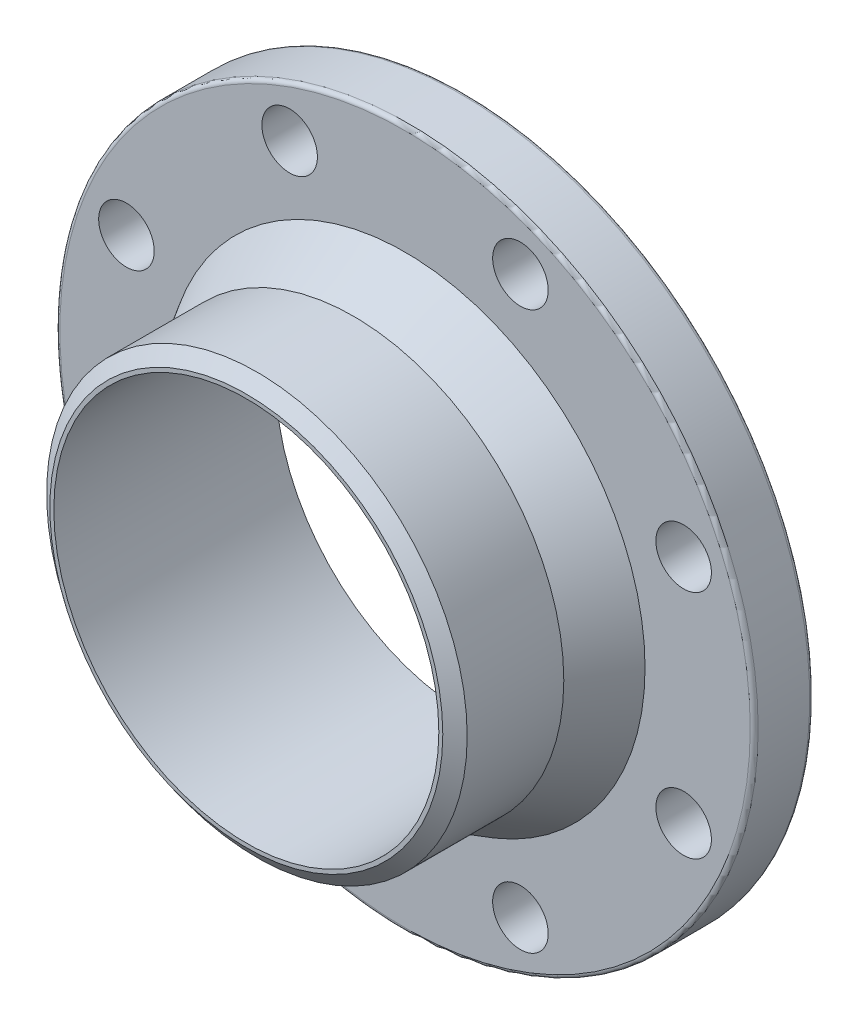
from build123d import *

# Parameters (mm, degrees)
SKETCH1_R                 = 139.7
BOSS_EXTRUDE1_DEPTH       = 25.4
SKETCH2_R                 = 11.1125
BOLTHOLE_DEPTH            = 200.191716695
BOLTHOLEPATTERN_COUNT     = 8
SKETCH5_OUTSIDE_W         = 360.59
SKETCH5_OUTSIDE_H         = 360.59
SKETCH5_OUTSIDE_R         = 107.95
RAISED_FACE_DEPTH         = 1.5875
SKETCH8_R                 = 96.0374
WELD_NECK_120_DRAFT_DEPTH = 63.5
WELD_NECK_120_DRAFT_TAPER = 30
WELD_NECK_END_REACH       = 218.646
SKETCH9_R                 = 84.1375
WELD_NECK_CHAMFER1_SIZE   = 4.239097945
WELD_NECK_CHAMFER1_SIZE2  = 5.5245
SKETCH7_R                 = 77.0255
BORE_DEPTH                = 217.645770787
FILLET2_R                 = 1.5875
FILLET3_R                 = 1.5875


with BuildPart() as part:
    # Sketch1 → Boss-Extrude1 (new body)
    with BuildSketch(Plane.XY):
        Circle(SKETCH1_R)
    extrude(amount=BOSS_EXTRUDE1_DEPTH)

    # Sketch2 → BoltHole (cut, through all)
    with BuildSketch(Plane.XY):
        with Locations((46.170756115, 111.466065597)):
            Circle(SKETCH2_R)
    bolthole = extrude(amount=BOLTHOLE_DEPTH, mode=Mode.SUBTRACT)

    # BoltHolePattern: BoltHole ×8 about axis
    boltholepattern_axis = Axis((0, 0, 0), (0, 0, 1))
    for i in range(1, BOLTHOLEPATTERN_COUNT):
        add(bolthole.rotate(boltholepattern_axis, i * 360 / BOLTHOLEPATTERN_COUNT), mode=Mode.SUBTRACT)

    # Sketch5 outside → Raised Face (cut)
    with BuildSketch(Plane(origin=(0, 0, 0), x_dir=(-1, 0, 0), z_dir=(0, 0, -1))):
        Rectangle(SKETCH5_OUTSIDE_W, SKETCH5_OUTSIDE_H)
        Circle(SKETCH5_OUTSIDE_R, mode=Mode.SUBTRACT)
    extrude(amount=-RAISED_FACE_DEPTH, mode=Mode.SUBTRACT)

    # Sketch8 → Weld Neck 120 Draft (add)
    with BuildSketch(Plane.XY.offset(25.4)):
        Circle(SKETCH8_R)
    extrude(amount=WELD_NECK_120_DRAFT_DEPTH, taper=WELD_NECK_120_DRAFT_TAPER)

    # Sketch9 → Weld Neck End (add, up to next)
    with BuildSketch(Plane.XY.offset(88.9), mode=Mode.PRIVATE) as weld_neck_end_sk1:
        Circle(SKETCH9_R)
    weld_neck_end_tool1 = extrude(weld_neck_end_sk1.sketch, amount=-WELD_NECK_END_REACH, mode=Mode.PRIVATE) - part.part
    add(weld_neck_end_tool1.solids().sort_by_distance((0, 0, 88.9))[0])

    # Weld Neck Chamfer1
    weld_neck_chamfer1_edges = [part.edges().sort_by_distance(p)[0] for p in [
        (-84.1375, 0, 88.9),
    ]]
    weld_neck_chamfer1_side = [part.faces().sort_by_distance(p)[0] for p in [
        (-84.1375, 0, 67.455615702),
    ]]
    chamfer(weld_neck_chamfer1_edges, length=WELD_NECK_CHAMFER1_SIZE, length2=WELD_NECK_CHAMFER1_SIZE2, reference=weld_neck_chamfer1_side[0])

    # Sketch7 → Bore (cut, through all)
    with BuildSketch(Plane.XY):
        Circle(SKETCH7_R)
    extrude(amount=BORE_DEPTH, mode=Mode.SUBTRACT)

    # Fillet2
    fillet2_edges = [part.edges().sort_by_distance(p)[0] for p in [
        (-139.7, 0, 25.4),
        (-139.7, 0, 1.5875),
    ]]
    fillet(fillet2_edges, radius=FILLET2_R)

    # Fillet3
    fillet3_edges = [part.edges().sort_by_distance(p)[0] for p in [
        (107.95, 0, 1.5875),
    ]]
    fillet(fillet3_edges, radius=FILLET3_R - 0.0001)  # a hair under: the kernel refuses the full size


solid = part.part
